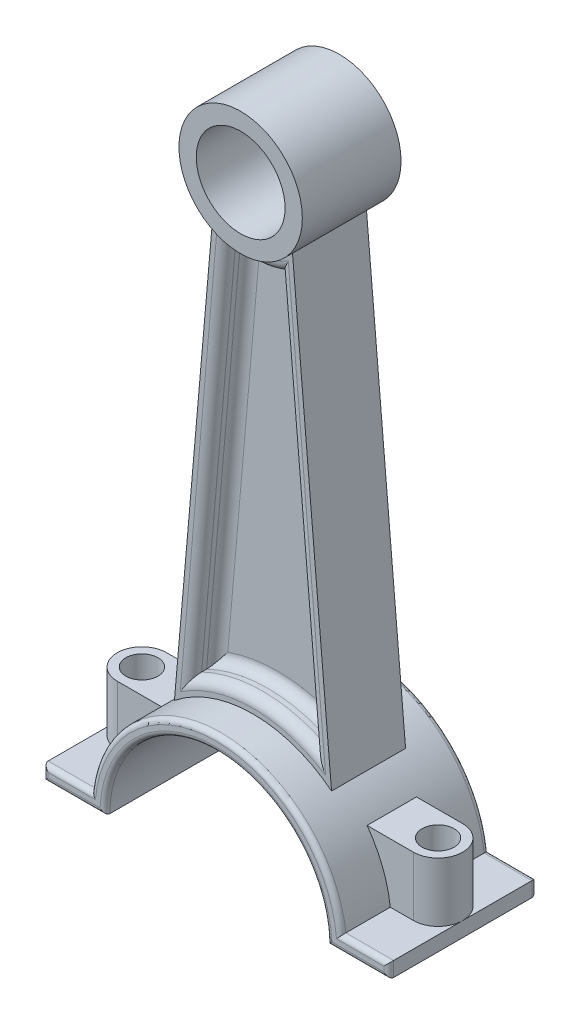
from build123d import *

# Parameters (mm, degrees)
SKETCH1_R           = 12.499999999999998
SKETCH1_R_2         = 9
BOSS_EXTRUDE2_DEPTH = 10
BOSS_EXTRUDE3_DEPTH = 15
BOSS_EXTRUDE5_DEPTH = 7.5
CUT_EXTRUDE2_START  = 7.5
CUT_EXTRUDE2_DEPTH  = 5
CUT_EXTRUDE3_START  = 12
CUT_EXTRUDE3_DEPTH  = 147.9824062980061
FILLET1_R           = 2
FILLET2_R           = 1


with BuildPart() as part:
    # Sketch1 → Boss-Extrude2 (new, symmetric)
    with BuildSketch(Plane.XY):
        Circle(SKETCH1_R)
        Circle(SKETCH1_R_2, mode=Mode.SUBTRACT)
    extrude(amount=BOSS_EXTRUDE2_DEPTH, both=True)



with BuildPart() as body_2:
    # Sketch1<8> → Boss-Extrude3 (new, symmetric)
    with BuildSketch(Plane.XY):
        with BuildLine():
            Line((-35, -119.99999999999999), (-22.49999999999999, -119.99999999999999))
            ThreePointArc((-22.49999999999999, -119.99999999999999), (1.108e-14, -97.5), (22.500000000000018, -119.99999999999999))
            Line((22.500000000000018, -119.99999999999999), (35, -119.99999999999999))
            Line((35, -119.99999999999999), (35, -116.99999999999999))
            Line((35, -116.99999999999999), (25.322914524201213, -116.99999999999999))
            ThreePointArc((25.322914524201213, -116.99999999999999), (1.626e-14, -94.5), (-25.322914524201185, -116.99999999999999))
            Line((-25.322914524201185, -116.99999999999999), (-35, -116.99999999999999))
            Line((-35, -116.99999999999999), (-35, -119.99999999999999))
        make_face()
    extrude(amount=BOSS_EXTRUDE3_DEPTH, both=True)


with BuildPart() as part_1:
    add(part.part)

    add(body_2.part)  # Boss-Extrude5 merges body 2
    # Sketch1<10> → Boss-Extrude5 (add, symmetric)
    with BuildSketch(Plane.XY):
        with BuildLine():
            Line((1.157e-14, -94.5), (1.53e-15, -12.499999999999998))
            ThreePointArc((-3.5757e-13, -12.499999999999998), (-4.253905296791233, -11.753905296790997), (-7.999999999999997, -9.604686356149273))
            Line((-7.999999999999998, -9.604686356149276), (-15.915237505263947, -100.07626503009439))
            ThreePointArc((-15.915237505263939, -100.07626503009439), (-8.43192618170404, -95.93441002455387), (-3.415e-13, -94.5))
        make_face()
        with BuildLine():
            ThreePointArc((7.999999999999995, -9.604686356149275), (4.253905296790895, -11.75390529679112), (-3.5757e-13, -12.499999999999998))
            Line((1.53e-15, -12.499999999999998), (1.157e-14, -94.5))
            ThreePointArc((-3.415e-13, -94.5), (8.431926181703737, -95.93441002455376), (15.91523750526397, -100.07626503009439))
            Line((15.915237505263978, -100.07626503009439), (8.000000000000002, -9.604686356149275))
        make_face()
    extrude(amount=BOSS_EXTRUDE5_DEPTH, both=True)

    # Sketch2 → Cut-Extrude2 (cut)
    with BuildSketch(Plane.XY.offset(CUT_EXTRUDE2_START)):
        with BuildLine():
            Line((12.401907754914848, -94.339861963766), (5.418745800218238, -14.521955582930874))
            ThreePointArc((5.418745800218238, -14.521955582930874), (4.39e-15, -15.5), (-5.418745800218231, -14.521955582930877))
            Line((-5.418745800218231, -14.521955582930877), (-12.401907754914824, -94.33986196376598))
            ThreePointArc((-12.401907754914824, -94.33986196376598), (1.644e-14, -91.5), (12.401907754914848, -94.339861963766))
        make_face()
    cut_extrude2 = extrude(amount=-CUT_EXTRUDE2_DEPTH, mode=Mode.SUBTRACT)

    # Mirror1: Cut-Extrude2 across plane
    add(cut_extrude2.mirror(Plane.XY), mode=Mode.SUBTRACT)

    # Boss-Extrude10: read off the stored shape, not the designer's step
    # Boss-Extrude10: loft between two sections, ruled curve by curve
    boss_extrude10_from = [
        Edge.make_three_point_arc((-30, -117, -5), (-33.535533906, -117, -3.535533906), (-35, -117, 0)),
        Edge.make_three_point_arc((-35, -117, 0), (-33.535533906, -117, 3.535533906), (-30, -117, 5)),
        Edge.make_line((-30, -117, 5), (-25.322914524, -117, 5)),
        Edge.make_line((-25.322914524, -117, -5), (-30, -117, -5)),
        Edge.make_line((-25.322914524, -117, -5), (-25.322914524, -117, 5)),
    ]
    boss_extrude10_to = [
        Edge.make_three_point_arc((-30, -105, -5), (-33.535533906, -105, -3.535533906), (-35, -105, 0)),
        Edge.make_three_point_arc((-35, -105, 0), (-33.535533906, -105, 3.535533906), (-30, -105, 5)),
        Edge.make_line((-30, -105, 5), (-20.621590627, -105, 5)),
        Edge.make_line((-20.621590627, -105, -5), (-30, -105, -5)),
        Edge.make_line((-20.621590627, -105, -5), (-20.621590627, -105, 5)),
    ]
    boss_extrude10 = Solid(Shell([*[Face.make_surface_from_curves(boss_extrude10_from[k], boss_extrude10_to[k]) for k in range(5)], Face(Wire(boss_extrude10_from)), Face(Wire(boss_extrude10_to))]))
    add(boss_extrude10)

    # Sketch3<4> → Cut-Extrude3 (cut, through all)
    with BuildSketch(Plane(origin=(0, -116.99999999999999, 0), x_dir=(1, 0, 0), z_dir=(0, 1, 0)).offset(CUT_EXTRUDE3_START)):
        with BuildLine():
            ThreePointArc((-26.750000000000004, 0), (-27.701902961143716, 2.298097038856271), (-29.99999999999998, 3.2500000000000004))
            Line((-30.000000000000004, 3.2500000000000004), (-30.000000000000004, -3.25))
            ThreePointArc((-29.99999999999997, -3.2500000000000004), (-27.701902961143713, -2.298097038856268), (-26.750000000000004, -8e-16))
        make_face()
        with BuildLine():
            Line((-30.000000000000004, -3.25), (-30.000000000000004, 3.2500000000000004))
            ThreePointArc((-29.99999999999998, 3.2500000000000004), (-33.25000000000001, -2.49e-15), (-29.99999999999997, -3.2500000000000004))
        make_face()
    cut_extrude3 = extrude(amount=-CUT_EXTRUDE3_DEPTH, mode=Mode.SUBTRACT)

    # Fillet1
    fillet1_edges = [part_1.edges().sort_by_distance(p)[0] for p in [
        (8.910326777566542, -54.430908773348435, 2.5),
        (1.643e-14, -91.5, 7.5),
        (-8.910326777566528, -54.430908773348435, 2.5),
        (4.88e-15, -15.499999999999998, 7.5),
        (1.643e-14, -91.5, 2.5),
        (4.88e-15, -15.499999999999998, 2.5),
        (8.910326777566542, -54.430908773348435, 7.5),
        (-8.910326777566528, -54.430908773348435, 7.5),
        (8.910326777566542, -54.430908773348435, -7.5),
        (4.88e-15, -15.499999999999998, -2.5),
        (-8.910326777566528, -54.430908773348435, -7.5),
        (1.643e-14, -91.5, -2.5),
        (8.910326777566542, -54.430908773348435, -2.5),
        (-8.910326777566528, -54.430908773348435, -2.5),
        (1.643e-14, -91.5, -7.5),
        (4.88e-15, -15.499999999999998, -7.5),
    ]]
    fillet(fillet1_edges, radius=FILLET1_R)

    # Mirror2: Boss-Extrude10, Cut-Extrude3 across plane
    add(boss_extrude10.mirror(Plane(origin=(0, 0, 0), x_dir=(0, 0, 1), z_dir=(1, 0, 0))))
    add(cut_extrude3.mirror(Plane(origin=(0, 0, 0), x_dir=(0, 0, 1), z_dir=(1, 0, 0))), mode=Mode.SUBTRACT)

    # Fillet2
    fillet2_edges = [part_1.edges().sort_by_distance(p)[0] for p in [
        (9.33e-15, -94.5, -15),
        (28.750000000000007, -119.99999999999999, -15),
        (35, -118.49999999999999, 15),
        (30.161457262100605, -116.99999999999999, 15),
        (-30.16145726210059, -116.99999999999999, 15),
        (-35, -118.49999999999999, -15),
        (-28.749999999999993, -119.99999999999999, -15),
        (1.383e-14, -97.5, 15),
        (28.750000000000007, -119.99999999999999, 15),
        (9.33e-15, -94.5, 15),
        (-35, -118.49999999999999, 15),
        (-28.749999999999993, -119.99999999999999, 15),
        (1.383e-14, -97.5, -15),
        (-30.16145726210059, -116.99999999999999, -15),
        (30.161457262100605, -116.99999999999999, -15),
        (35, -118.49999999999999, -15),
    ]]
    fillet(fillet2_edges, radius=FILLET2_R)


solid = part_1.part
